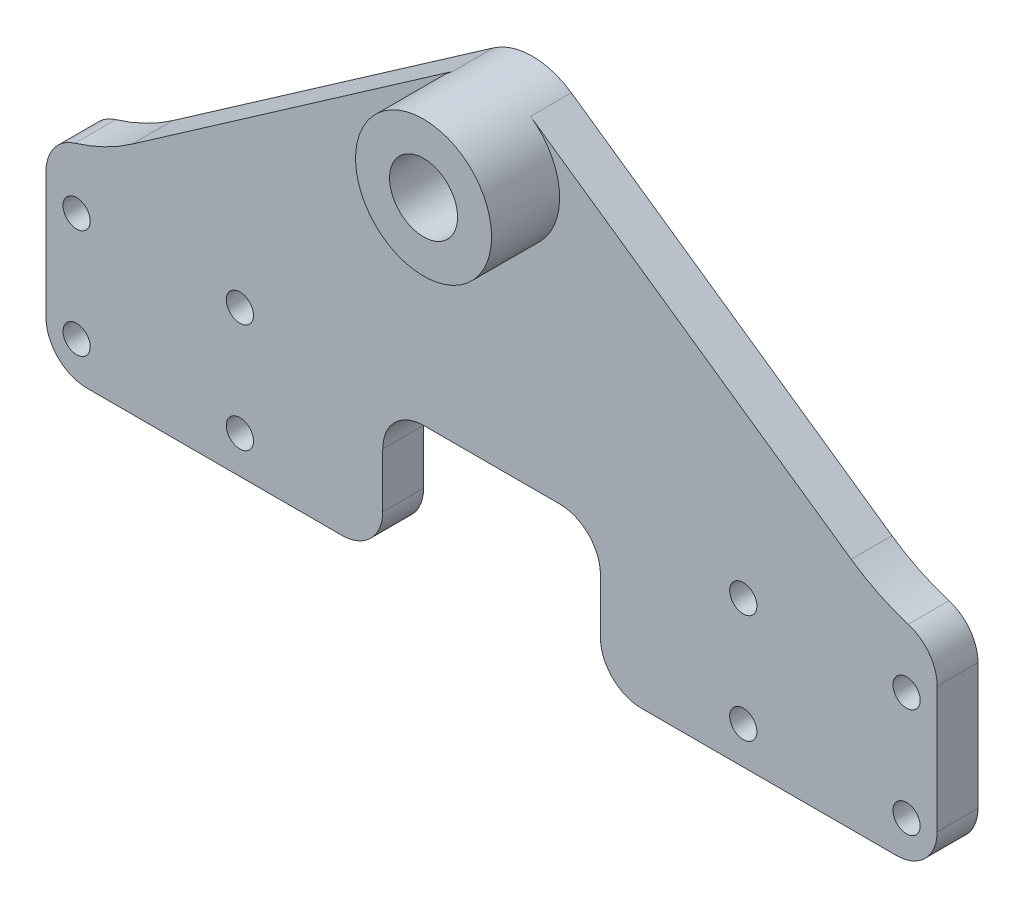
from build123d import *

# Parameters (mm, degrees)
SKETCH_1_W          = 4
SKETCH_1_H          = 13.5
EXTRUDE_1_DEPTH     = 3
EXTRUDE_1_2_DEPTH   = 3
EXTRUDE_1_3_DEPTH   = 3
EXTRUDE_1_4_DEPTH   = 3
SKETCH_2_R          = 2.5
EXTRUDE_2_DEPTH     = 3
FILLET_3_R          = 3
FILLET_4_R          = 5
CHAMFER_1_SIZE      = 0.5
SKETCH_5_R          = 1
CUT_EXTRUDE_3_DEPTH = 4
CUT_EXTRUDE_START   = -14
CUT_EXTRUDE_4_DEPTH = 14
FILLET_6_R          = 3
SKETCH_10_R         = 2.5
EXTRUDE_5_DEPTH     = 5


with BuildPart() as part:
    # 草图1 → 凸台-拉伸1 (new body)
    with BuildSketch(Plane.XY):
        with Locations((-35, -41.75)):
            Rectangle(SKETCH_1_W, SKETCH_1_H)
    extrude(amount=EXTRUDE_1_DEPTH)



with BuildPart() as body_2:
    # 草图1 → Extrude 1 2 (new body)
    with BuildSketch(Plane.XY):
        with Locations((-14, -41.75)):
            Rectangle(SKETCH_1_W, SKETCH_1_H)
    extrude(amount=EXTRUDE_1_2_DEPTH)


with BuildPart() as body_3:
    # 草图1 → Extrude 1 3 (new body)
    with BuildSketch(Plane.XY):
        with Locations((14, -41.75)):
            Rectangle(SKETCH_1_W, SKETCH_1_H)
    extrude(amount=EXTRUDE_1_3_DEPTH)


with BuildPart() as body_4:
    # 草图1 → Extrude 1 4 (new body)
    with BuildSketch(Plane.XY):
        with Locations((35, -41.75)):
            Rectangle(SKETCH_1_W, SKETCH_1_H)
    extrude(amount=EXTRUDE_1_4_DEPTH)


with BuildPart() as part_1:
    add(part.part)

    add(body_2.part)  # 凸台-拉伸2 merges body 2

    add(body_3.part)  # 凸台-拉伸2 merges body 3

    add(body_4.part)  # 凸台-拉伸2 merges body 4
    # 草图2 → 凸台-拉伸2 (add)
    with BuildSketch(Plane.XY.offset(3)):
        with BuildLine():
            Line((-37, -35), (-37, -48.5))
            Line((-37, -48.5), (-12, -48.5))
            Line((-12, -48.5), (-8, -48.5))
            Line((-8, -48.5), (-8, -38.5))
            Line((-8, -38.5), (8, -38.5))
            Line((8, -38.5), (8, -48.5))
            Line((8, -48.5), (12, -48.5))
            Line((12, -48.5), (37, -48.5))
            Line((37, -48.5), (37, -35))
            Line((37, -35), (37, -34))
            Line((37, -34), (35, -34))
            ThreePointArc((35, -34), (30.508154972, -33.311650088), (26.428571429, -31.3097771))
            Line((26.428571429, -31.3097771), (2.857142857, -14.896740967))
            ThreePointArc((2.857142857, -14.896740967), (0, -14), (-2.857142857, -14.896740967))
            Line((-2.857142857, -14.896740967), (-26.428571429, -31.3097771))
            ThreePointArc((-26.428571429, -31.3097771), (-30.508154972, -33.311650088), (-35, -34))
            Line((-35, -34), (-37, -34))
            Line((-37, -34), (-37, -35))
        make_face()
        with Locations((0, -19)):
            Circle(SKETCH_2_R, mode=Mode.SUBTRACT)
    extrude(amount=EXTRUDE_2_DEPTH)

    # 圆角3
    fillet_3_edges = [part_1.edges().sort_by_distance(p)[0] for p in [
        (-8, -48.5, 4.5),
        (-8, -38.5, 4.5),
        (8, -38.5, 4.5),
        (8, -48.5, 4.5),
        (37, -48.5, 3),
        (-37, -48.5, 3),
    ]]
    fillet(fillet_3_edges, radius=FILLET_3_R)

    # 圆角4
    # the kernel refuses this fillet: 5 mm, written as the material it takes off along each edge
    with BuildSketch(Plane(origin=(37, -34, -8.934299833), x_dir=(0, -1, 0), z_dir=(0, 0, 1))) as fillet_4_piece_1:
        with BuildLine():
            CenterArc((4.773719933, -5), FILLET_4_R, 90, 81.373073441)
            Line((-0.16971005, -4.25), (-0.664053048, -4.175))
            ThreePointArc((-0.664053048, -4.175), (-0.5, -2), (-0.5, 0))
            Line((-0.5, 0), (0, 0.5))
            Line((0, 0.5), (4.773719933, 0.5))
            Line((4.773719933, 0.5), (4.773719933, 0))
        make_face()
    extrude(amount=26.868599666, mode=Mode.SUBTRACT)
    with BuildSketch(Plane(origin=(-37, -34, -8.934299833), x_dir=(0.9992036788156995, 0.039899977959549054, 0), z_dir=(0, 0, 1))) as fillet_4_piece_2:
        with BuildLine():
            CenterArc((4.805547074, -4.969418409), FILLET_4_R, 96.340219202, 81.373073441)
            Line((-0.19047132, -4.769918519), (-0.69007316, -4.74996853))
            Line((-0.69007316, -4.74996853), (-0.499601839, 0.019949989))
            Line((-0.499601839, 0.019949989), (0.019949989, 0.499601839))
            ThreePointArc((0.019949989, 0.499601839), (2.018357347, 0.419801883), (4.198171061, 0.496941841))
            Line((4.198171061, 0.496941841), (4.253387062, 0))
        make_face()
    extrude(amount=26.868599666, mode=Mode.SUBTRACT)

    # 倒角1
    chamfer_1_edges = [part_1.edges().sort_by_distance(p)[0] for p in [
        (-16, -41.75, 0),
        (-33, -41.75, 0),
        (16, -41.75, 0),
        (33, -41.75, 0),
    ]]
    chamfer(chamfer_1_edges, length=CHAMFER_1_SIZE)

    # 草图5 → 切除-拉伸3 (cut)
    with BuildSketch(Plane.XY.offset(6)):
        with Locations((-18.5, -45.75)):
            Circle(SKETCH_5_R)
        with Locations((-18.5, -37.75)):
            Circle(SKETCH_5_R)
        with Locations((-30.5, -45.75)):
            Circle(SKETCH_5_R)
        with Locations((-30.5, -37.75)):
            Circle(SKETCH_5_R)
        with Locations((18.5, -45.75)):
            Circle(SKETCH_5_R)
        with Locations((18.5, -37.75)):
            Circle(SKETCH_5_R)
        with Locations((30.5, -45.75)):
            Circle(SKETCH_5_R)
        with Locations((30.5, -37.75)):
            Circle(SKETCH_5_R)
    extrude(amount=-CUT_EXTRUDE_3_DEPTH, mode=Mode.SUBTRACT)

    # 草图9 → 切除-拉伸4 (cut)
    with BuildSketch(Plane.XY.offset(6).offset(CUT_EXTRUDE_START)):
        with BuildLine():
            Line((37, -45.5), (37, -38.773719933))
            ThreePointArc((37, -38.773719933), (35.791437722, -35.514118731), (32.75, -33.83028995))
            Line((32.75, -33.83028995), (32.75, -48.5))
            Line((32.75, -48.5), (34, -48.5))
            ThreePointArc((34, -48.5), (36.121320344, -47.621320344), (37, -45.5))
        make_face()
        with BuildLine():
            Line((-32.75, -33.83028995), (-32.75, -48.5))
            Line((-32.75, -48.5), (-34, -48.5))
            ThreePointArc((-34, -48.5), (-36.121320344, -47.621320344), (-37, -45.5))
            Line((-37, -45.5), (-37, -38.773719933))
            ThreePointArc((-37, -38.773719933), (-35.791437722, -35.514118731), (-32.75, -33.83028995))
        make_face()
    extrude(amount=CUT_EXTRUDE_4_DEPTH, mode=Mode.SUBTRACT)

    # 圆角6
    fillet_6_edges = [part_1.edges().sort_by_distance(p)[0] for p in [
        (32.75, -33.83028995, 4.5),
        (-32.75, -33.83028995, 4.5),
        (32.75, -48.5, 4.5),
        (-32.75, -48.5, 4.5),
    ]]
    fillet(fillet_6_edges, radius=FILLET_6_R)

    # 草图10 → 凸台-拉伸5 (add)
    with BuildSketch(Plane.XY.offset(6)):
        with BuildLine():
            ThreePointArc((5, -19), (4.432026302, -16.685449751), (2.857142857, -14.896740967))
            ThreePointArc((2.857142857, -14.896740967), (0, -14), (-2.857142857, -14.896740967))
            ThreePointArc((-2.857142857, -14.896740967), (-2.314550249, -23.432026302), (5, -19))
        make_face()
        with Locations((0, -19)):
            Circle(SKETCH_10_R, mode=Mode.SUBTRACT)
    extrude(amount=EXTRUDE_5_DEPTH)


solid = part_1.part
